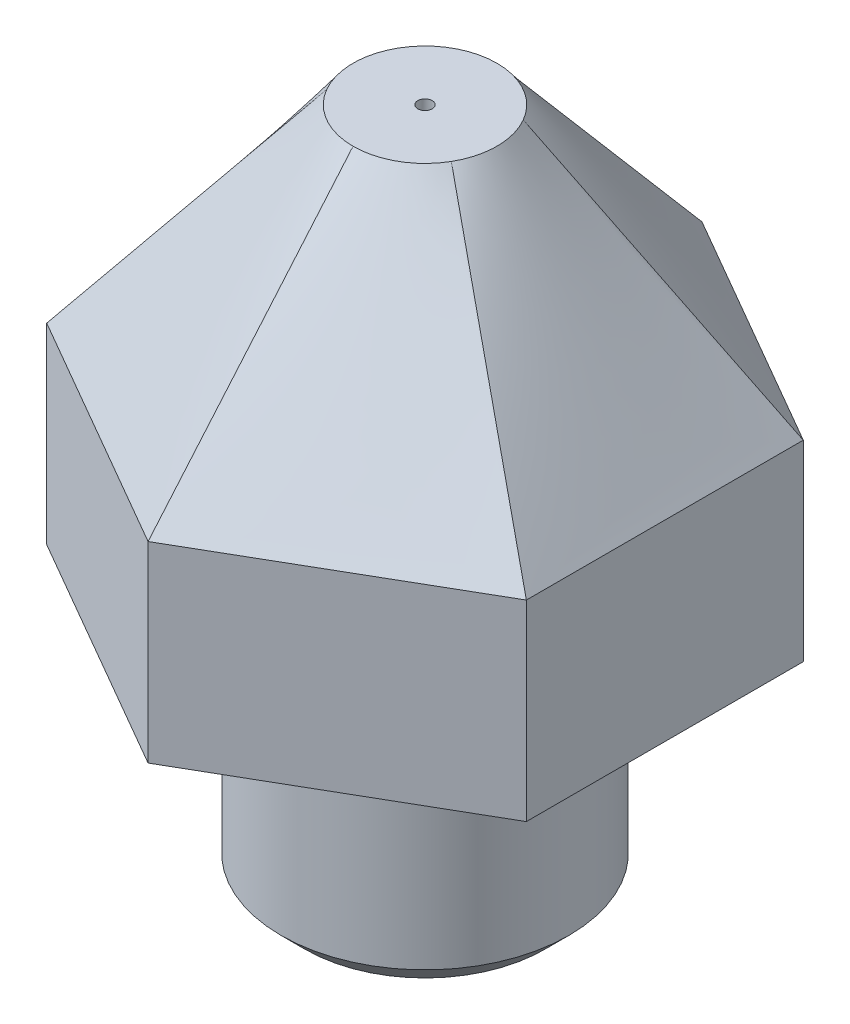
from build123d import *

# Parameters (mm, degrees)
SKETCH1_R           = 3
BOSS_EXTRUDE1_DEPTH = 5
BOSS_EXTRUDE2_DEPTH = 4
CHAMFER1_SIZE       = 0.5
SKETCH5_R           = 0.15
SKETCH4_R           = 0.5


with BuildPart() as part:
    # Sketch1 → Boss-Extrude1 (new body)
    with BuildSketch(Plane(origin=(0, 0, 0), x_dir=(1, 0, 0), z_dir=(0, 1, 0))):
        with Locations(Location((0, 0, 0), (0, 0, 270))):
            Circle(SKETCH1_R)
    extrude(amount=BOSS_EXTRUDE1_DEPTH)

    # Sketch2 → Boss-Extrude2 (add)
    with BuildSketch(Plane(origin=(0, 5, 0), x_dir=(1, 0, 0), z_dir=(0, 1, 0))):
        Polygon((0, 5.773502692), (-5, 2.886751346), (-5, -2.886751346), (0, -5.773502692), (5, -2.886751346), (5, 2.886751346), align=None)
    extrude(amount=BOSS_EXTRUDE2_DEPTH)

    # Chamfer1
    chamfer1_edges = [part.edges().sort_by_distance(p)[0] for p in [
        (0, 0, -3),
    ]]
    chamfer(chamfer1_edges, length=CHAMFER1_SIZE)

    # Loft1: read off the stored shape, not the designer's step
    # Loft1: loft between two sections, ruled curve by curve
    loft1_from = [
        Edge.make_bspline([(1.299038106, 14, -0.75), (1.424038106, 14, -0.533493649), (1.5, 14, -0.267949192), (1.5, 14, 0.267949192), (1.424038106, 14, 0.533493649), (1.299038106, 14, 0.75)], [0, 0, 0, 0, 0.5, 0.5, 1, 1, 1, 1], 3),
        Edge.make_bspline([(1.299038106, 14, 0.75), (1.174038106, 14, 0.966506351), (0.982050808, 14, 1.165063509), (0.517949192, 14, 1.433012702), (0.25, 14, 1.5), (0, 14, 1.5)], [0, 0, 0, 0, 0.5, 0.5, 1, 1, 1, 1], 3),
        Edge.make_bspline([(0, 14, -1.5), (0.25, 14, -1.5), (0.517949192, 14, -1.433012702), (0.982050808, 14, -1.165063509), (1.174038106, 14, -0.966506351), (1.299038106, 14, -0.75)], [0, 0, 0, 0, 0.5, 0.5, 1, 1, 1, 1], 3),
        Edge.make_bspline([(0, 14, 1.5), (-0.25, 14, 1.5), (-0.517949192, 14, 1.433012702), (-0.982050808, 14, 1.165063509), (-1.174038106, 14, 0.966506351), (-1.299038106, 14, 0.75)], [0, 0, 0, 0, 0.5, 0.5, 1, 1, 1, 1], 3),
        Edge.make_bspline([(-1.299038106, 14, 0.75), (-1.424038106, 14, 0.533493649), (-1.5, 14, 0.267949192), (-1.5, 14, -0.267949192), (-1.424038106, 14, -0.533493649), (-1.299038106, 14, -0.75)], [0, 0, 0, 0, 0.5, 0.5, 1, 1, 1, 1], 3),
        Edge.make_bspline([(-1.299038106, 14, -0.75), (-1.174038106, 14, -0.966506351), (-0.982050808, 14, -1.165063509), (-0.517949192, 14, -1.433012702), (-0.25, 14, -1.5), (0, 14, -1.5)], [0, 0, 0, 0, 0.5, 0.5, 1, 1, 1, 1], 3),
    ]
    loft1_to = [
        Edge.make_bspline([(5, 9, -2.886751346), (5, 9, -1.924500897), (5, 9, -0.962250449), (5, 9, 0.962250449), (5, 9, 1.924500897), (5, 9, 2.886751346)], [0, 0, 0, 0, 0.5, 0.5, 1, 1, 1, 1], 3),
        Edge.make_bspline([(5, 9, 2.886751346), (4.166666667, 9, 3.36787657), (3.333333333, 9, 3.849001795), (1.666666667, 9, 4.811252243), (0.833333333, 9, 5.292377468), (0, 9, 5.773502692)], [0, 0, 0, 0, 0.5, 0.5, 1, 1, 1, 1], 3),
        Edge.make_bspline([(0, 9, -5.773502692), (0.833333333, 9, -5.292377468), (1.666666667, 9, -4.811252243), (3.333333333, 9, -3.849001795), (4.166666667, 9, -3.36787657), (5, 9, -2.886751346)], [0, 0, 0, 0, 0.5, 0.5, 1, 1, 1, 1], 3),
        Edge.make_bspline([(0, 9, 5.773502692), (-0.833333333, 9, 5.292377468), (-1.666666667, 9, 4.811252243), (-3.333333333, 9, 3.849001795), (-4.166666667, 9, 3.36787657), (-5, 9, 2.886751346)], [0, 0, 0, 0, 0.5, 0.5, 1, 1, 1, 1], 3),
        Edge.make_bspline([(-5, 9, 2.886751346), (-5, 9, 1.924500897), (-5, 9, 0.962250449), (-5, 9, -0.962250449), (-5, 9, -1.924500897), (-5, 9, -2.886751346)], [0, 0, 0, 0, 0.5, 0.5, 1, 1, 1, 1], 3),
        Edge.make_bspline([(-5, 9, -2.886751346), (-4.166666667, 9, -3.36787657), (-3.333333333, 9, -3.849001795), (-1.666666667, 9, -4.811252243), (-0.833333333, 9, -5.292377468), (0, 9, -5.773502692)], [0, 0, 0, 0, 0.5, 0.5, 1, 1, 1, 1], 3),
    ]
    loft1 = Solid(Shell([*[Face.make_surface_from_curves(loft1_from[k], loft1_to[k]) for k in range(6)], Face(Wire(loft1_from)), Face(Wire(loft1_to))]))
    add(loft1)

    # Sketch5 → Cut-Loft1 section 0
    with BuildSketch(Plane(origin=(0, 14, 0), x_dir=(-1, 0, 0), z_dir=(0, 1, 0))):
        Circle(SKETCH5_R)
    # Sketch4 → Cut-Loft1 section 1
    with BuildSketch(Plane.XZ):
        Circle(SKETCH4_R)
    loft(mode=Mode.SUBTRACT)


solid = part.part
